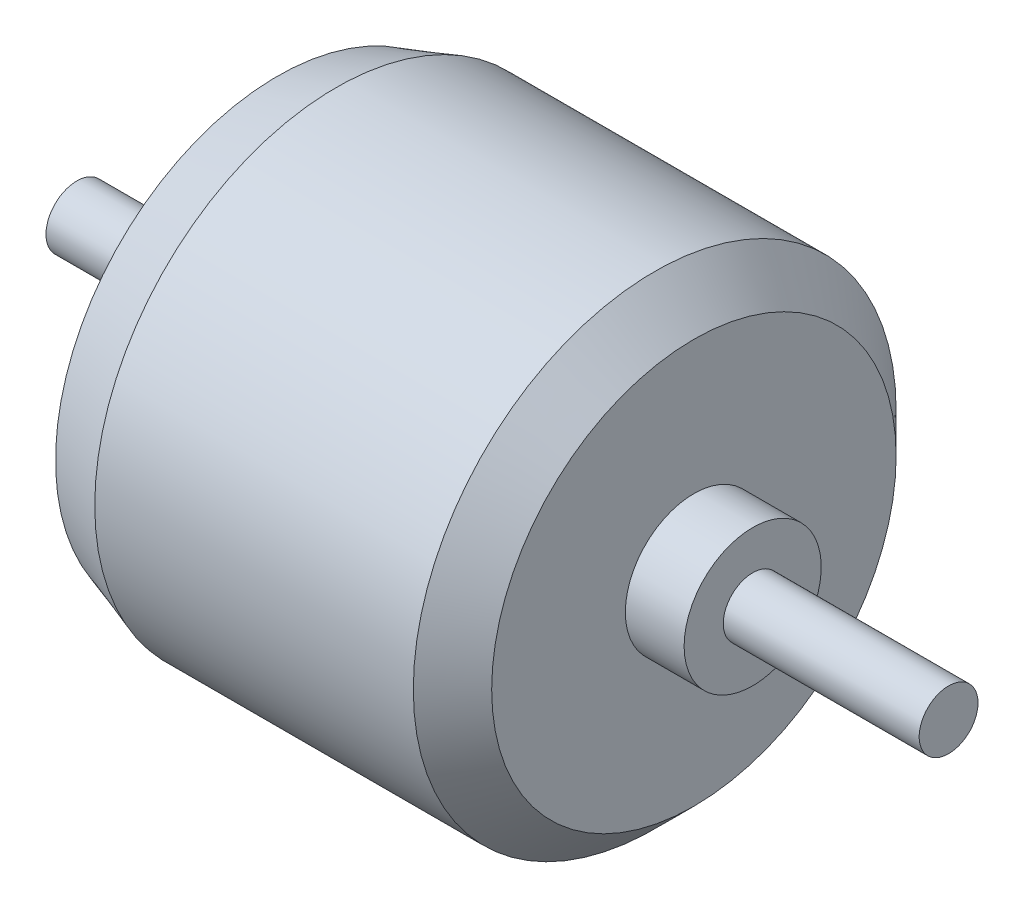
from build123d import *

# Parameters (mm, degrees)
SKETCH2_R           = 4
BOSS_EXTRUDE1_DEPTH = 26
SKETCH3_R           = 31.3
BOSS_EXTRUDE2_DEPTH = 54
SKETCH4_R           = 2
CUT_EXTRUDE1_DEPTH  = 8
CHAMFER1_SIZE       = 2.54
CHAMFER1_SIZE2      = 7.62
CHAMFER2_SIZE       = 5.08
SKETCH5_R           = 8.89
BOSS_EXTRUDE3_DEPTH = 7.62
SKETCH6_R           = 3.812788388
BOSS_EXTRUDE4_DEPTH = 25.4


with BuildPart() as part:
    # Sketch2 → Boss-Extrude1 (new body)
    with BuildSketch(Plane(origin=(0, 0, 0), x_dir=(0, 0, -1), z_dir=(1, 0, 0))):
        Circle(SKETCH2_R)
    extrude(amount=BOSS_EXTRUDE1_DEPTH)

    # Sketch3 → Boss-Extrude2 (add)
    with BuildSketch(Plane(origin=(26, 0, 0), x_dir=(0, 0, -1), z_dir=(1, 0, 0))):
        Circle(SKETCH3_R)
    extrude(amount=BOSS_EXTRUDE2_DEPTH)

    # Sketch4 → Cut-Extrude1 (cut)
    with BuildSketch(Plane.ZY.offset(-26)):
        with Locations((15, 0)):
            Circle(SKETCH4_R)
        with Locations((0, -22)):
            Circle(SKETCH4_R)
        with Locations((0, -15)):
            Circle(SKETCH4_R)
        with Locations((-15, 0)):
            Circle(SKETCH4_R)
        with Locations((0, 15)):
            Circle(SKETCH4_R)
        with Locations((0, 22)):
            Circle(SKETCH4_R)
        with Locations((22, 0)):
            Circle(SKETCH4_R)
        with Locations((-22, 0)):
            Circle(SKETCH4_R)
    extrude(amount=-CUT_EXTRUDE1_DEPTH, mode=Mode.SUBTRACT)

    # Chamfer1
    chamfer1_edges = [part.edges().sort_by_distance(p)[0] for p in [
        (26, 0, 31.3),
    ]]
    chamfer1_side = [part.faces().sort_by_distance(p)[0] for p in [
        (26, 0, 30.41470231),
    ]]
    chamfer(chamfer1_edges, length=CHAMFER1_SIZE, length2=CHAMFER1_SIZE2, reference=chamfer1_side[0])

    # Chamfer2
    chamfer2_edges = [part.edges().sort_by_distance(p)[0] for p in [
        (80, 0, 31.3),
    ]]
    chamfer(chamfer2_edges, length=CHAMFER2_SIZE)

    # Sketch5 → Boss-Extrude3 (add)
    with BuildSketch(Plane(origin=(80, 0, 0), x_dir=(0, 0, -1), z_dir=(1, 0, 0))):
        Circle(SKETCH5_R)
    extrude(amount=BOSS_EXTRUDE3_DEPTH)

    # Sketch6 → Boss-Extrude4 (add)
    with BuildSketch(Plane(origin=(87.62, 0, 0), x_dir=(0, 0, -1), z_dir=(1, 0, 0))):
        Circle(SKETCH6_R)
    extrude(amount=BOSS_EXTRUDE4_DEPTH)


solid = part.part
